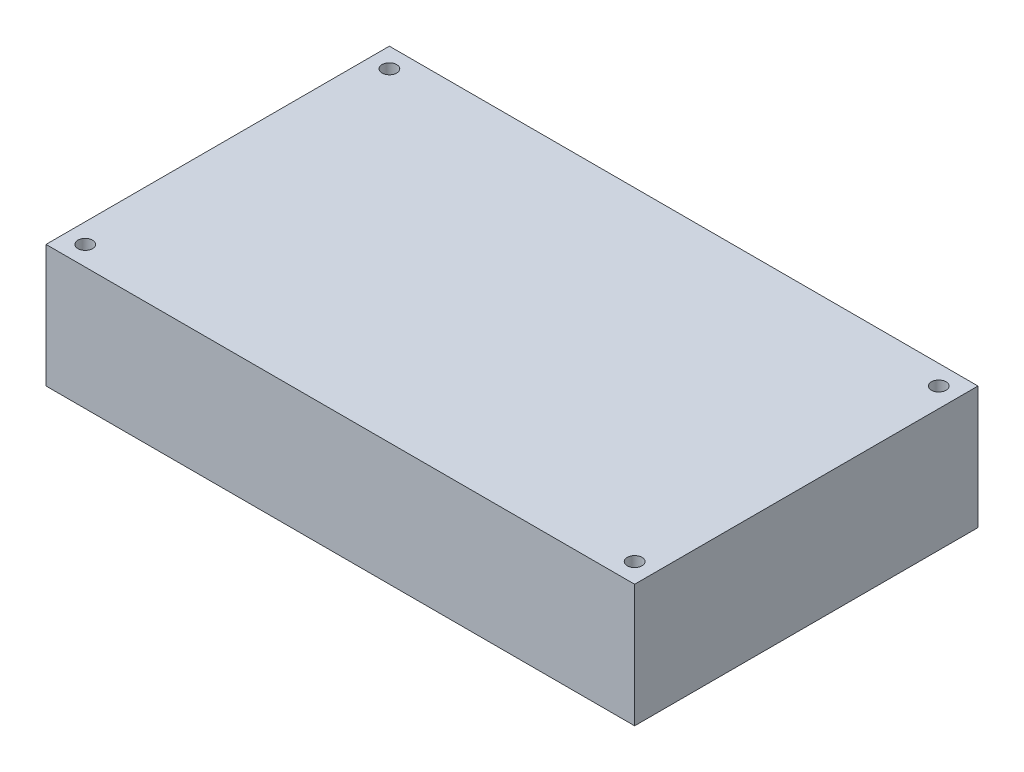
from build123d import *

# Parameters (mm, degrees)
SKETCH1_W               = 120
SKETCH1_H               = 70
BOSS_EXTRUDE1_DEPTH     = 25
CUT_EXTRUDE1_DEPTH      = 74.824115301
CUT_EXTRUDE1_DEPTH_BACK = 74.824115301
SKETCH2_R               = 1.5


with BuildPart() as part:
    # Sketch1 → Boss-Extrude1 (new body)
    with BuildSketch(Plane(origin=(0, 0, 0), x_dir=(1, 0, 0), z_dir=(0, 1, 0))):
        Rectangle(SKETCH1_W, SKETCH1_H)
    extrude(amount=BOSS_EXTRUDE1_DEPTH)

    # Sketch2 → Cut-Extrude1 (cut, two sides: drawn at the far end of the back side and taken through both)
    with BuildSketch(Plane(origin=(0, 25, 0), x_dir=(1, 0, 0), z_dir=(0, 1, 0)).offset(-CUT_EXTRUDE1_DEPTH_BACK)):
        with Locations((-56, 31)):
            Circle(SKETCH2_R)
        with Locations((56, 31)):
            Circle(SKETCH2_R)
        with Locations((56, -31)):
            Circle(SKETCH2_R)
        with Locations((-56, -31)):
            Circle(SKETCH2_R)
    extrude(amount=CUT_EXTRUDE1_DEPTH + CUT_EXTRUDE1_DEPTH_BACK, mode=Mode.SUBTRACT)


solid = part.part
